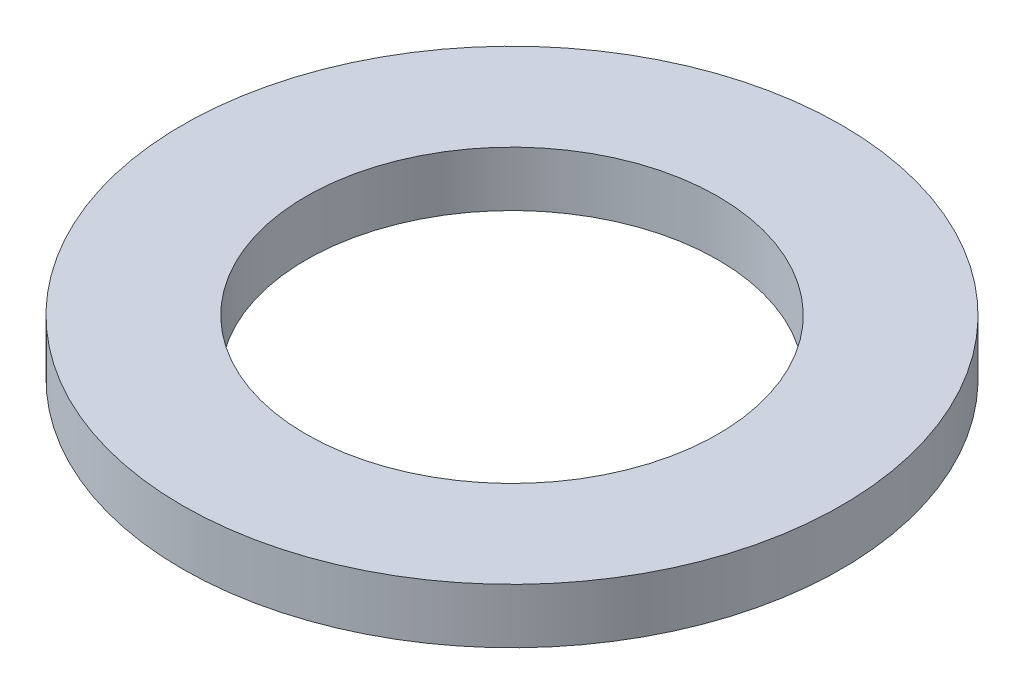
from build123d import *

# Parameters (mm, degrees)
SKETCH1_R           = 60
BOSS_EXTRUDE1_DEPTH = 10
SKETCH2_R           = 37.5
CUT_EXTRUDE1_DEPTH  = 86.440037453


with BuildPart() as part:
    # Sketch1 → Boss-Extrude1 (new body)
    with BuildSketch(Plane(origin=(0, 0, 0), x_dir=(1, 0, 0), z_dir=(0, 1, 0))):
        Circle(SKETCH1_R)
    extrude(amount=BOSS_EXTRUDE1_DEPTH)

    # Sketch2 → Cut-Extrude1 (cut, through all)
    with BuildSketch(Plane(origin=(0, 0, 0), x_dir=(1, 0, 0), z_dir=(0, 1, 0))):
        Circle(SKETCH2_R)
    extrude(amount=CUT_EXTRUDE1_DEPTH, mode=Mode.SUBTRACT)


solid = part.part
